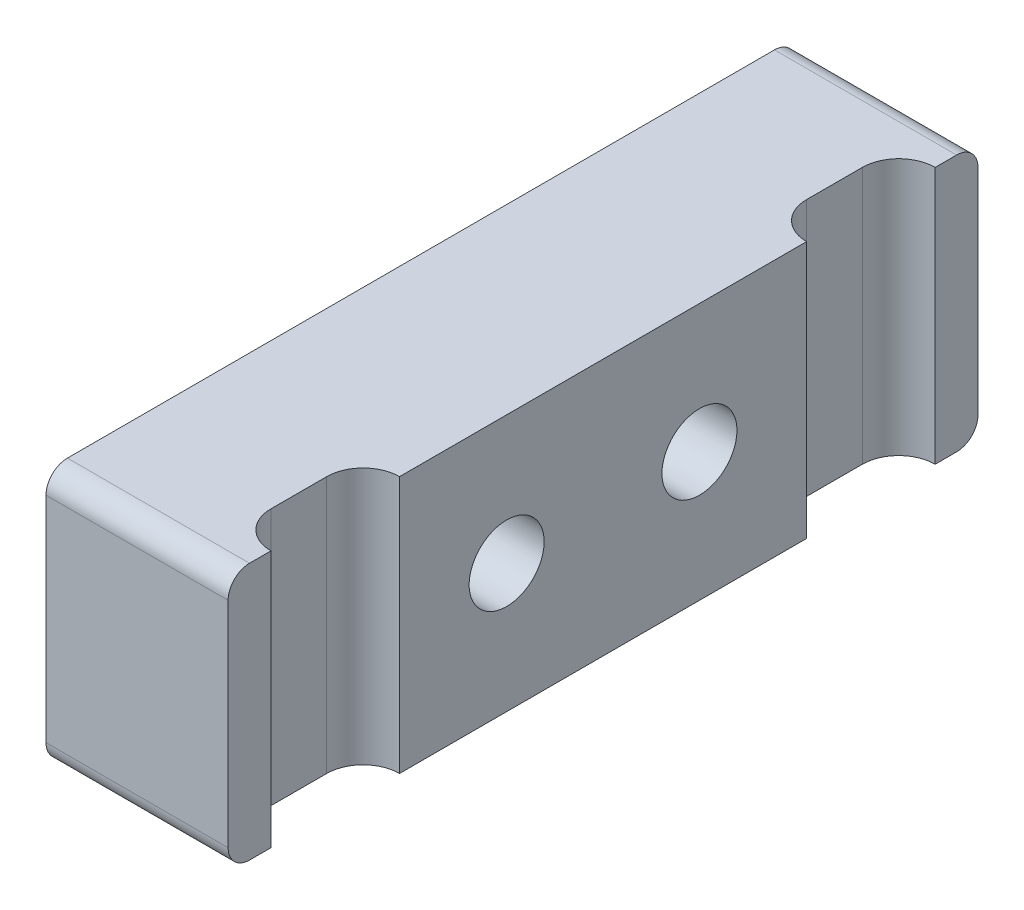
from build123d import *

# Parameters (mm, degrees)
BASE_DEPTH                = 12
CASE_MOUNTING_HOLES_REACH = 24.858
SKETCH2_R                 = 1.75
F_1MM_EDGE_FILLETS_R      = 1


with BuildPart() as part:
    # Sketch1 → Base (new body)
    with BuildSketch(Plane(origin=(0, 0, 0), x_dir=(1, 0, 0), z_dir=(0, 1, 0))):
        with BuildLine():
            Line((8.5, 17.5), (8.5, 15.5))
            ThreePointArc((8.5, 15.5), (7.297918472, 15.002081528), (6.8, 13.8))
            Line((6.8, 13.8), (6.8, 11.2))
            ThreePointArc((6.8, 11.2), (7.297918472, 9.997918472), (8.5, 9.5))
            Line((8.5, 9.5), (8.5, -9.5))
            ThreePointArc((8.5, -9.5), (7.297918472, -9.997918472), (6.8, -11.2))
            Line((6.8, -11.2), (6.8, -13.8))
            ThreePointArc((6.8, -13.8), (7.297918472, -15.002081528), (8.5, -15.5))
            Line((8.5, -15.5), (8.5, -17.5))
            Line((8.5, -17.5), (0, -17.5))
            Line((0, -17.5), (0, 17.5))
            Line((0, 17.5), (8.5, 17.5))
        make_face()
    extrude(amount=BASE_DEPTH)

    # Sketch2 → Case Mounting Holes (cut, up to next)
    with BuildSketch(Plane(origin=(8.5, 0, 0), x_dir=(0, 0, -1), z_dir=(1, 0, 0)), mode=Mode.PRIVATE) as case_mounting_holes_sk1:
        with Locations((-4.5, 6)):
            Circle(SKETCH2_R)
    case_mounting_holes_tool1 = extrude(case_mounting_holes_sk1.sketch, amount=-CASE_MOUNTING_HOLES_REACH, mode=Mode.PRIVATE) & part.part
    # Sketch2 → Case Mounting Holes (cut, up to next)
    with BuildSketch(Plane(origin=(8.5, 0, 0), x_dir=(0, 0, -1), z_dir=(1, 0, 0)), mode=Mode.PRIVATE) as case_mounting_holes_sk2:
        with Locations((4.5, 6)):
            Circle(SKETCH2_R)
    case_mounting_holes_tool2 = extrude(case_mounting_holes_sk2.sketch, amount=-CASE_MOUNTING_HOLES_REACH, mode=Mode.PRIVATE) & part.part
    add(case_mounting_holes_tool1.solids().sort_by_distance((8.5, 6, 4.5))[0], mode=Mode.SUBTRACT)
    add(case_mounting_holes_tool2.solids().sort_by_distance((8.5, 6, -4.5))[0], mode=Mode.SUBTRACT)

    # 1mm Edge Fillets
    f_1mm_edge_fillets_edges = [part.edges().sort_by_distance(p)[0] for p in [
        (4.25, 12, -17.5),
        (4.25, 0, -17.5),
        (4.25, 0, 17.5),
        (4.25, 12, 17.5),
    ]]
    fillet(f_1mm_edge_fillets_edges, radius=F_1MM_EDGE_FILLETS_R)


solid = part.part
